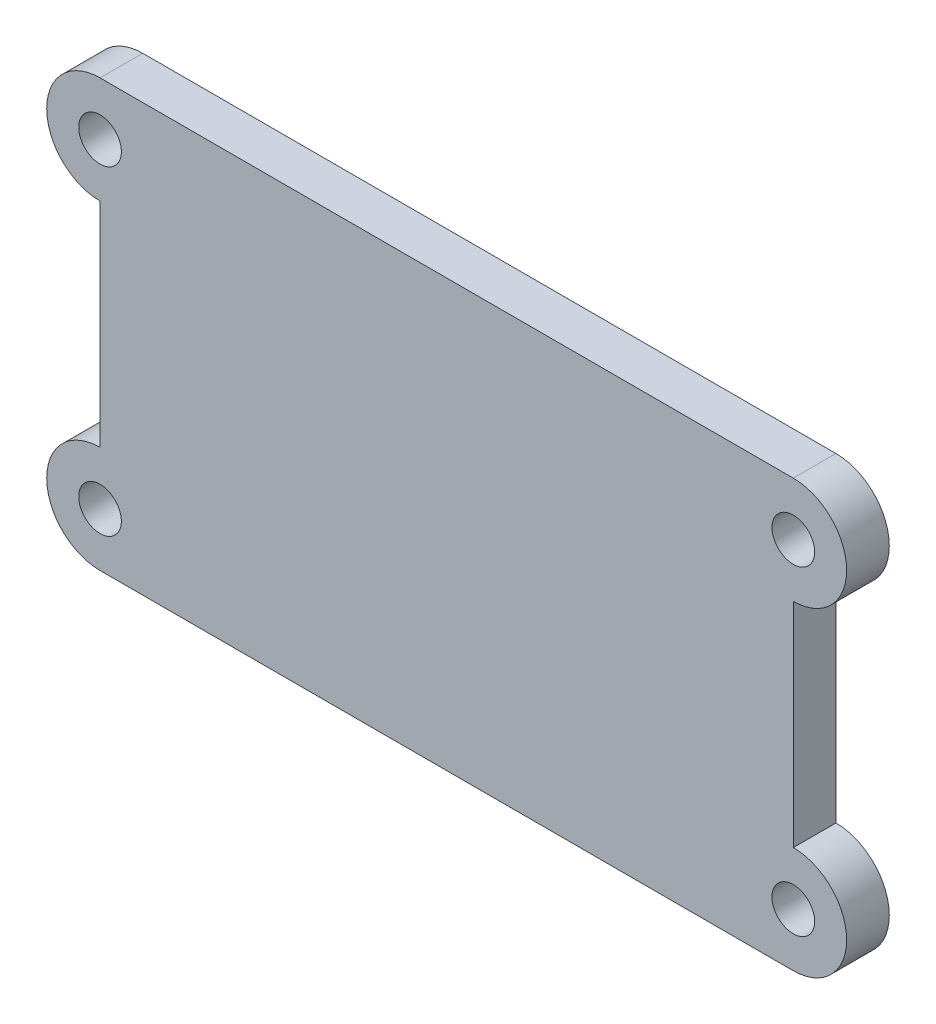
from build123d import *

# Parameters (mm, degrees)
SKETCH1_W                                  = 65
SKETCH1_H                                  = 40
BOSS_EXTRUDE1_DEPTH                        = 4
BOSS_EXTRUDE2_DEPTH                        = 4
SKETCH3_R                                  = 2
CUT_EXTRUDE1_DEPTH                         = 4
MIRROR1_AT_THE_SECOND_PLANE_COPY_1_DEPTH   = 4
MIRROR1_AT_THE_SECOND_PLANE_COPY_2_SKETC_R = 2
MIRROR1_AT_THE_SECOND_PLANE_COPY_2_DEPTH   = 4


with BuildPart() as part:
    # Sketch1 → Boss-Extrude1 (new body)
    with BuildSketch(Plane.XY):
        Rectangle(SKETCH1_W, SKETCH1_H)
    extrude(amount=BOSS_EXTRUDE1_DEPTH)

    # Sketch2 → Boss-Extrude2 (add)
    with BuildSketch(Plane.XY):
        with BuildLine():
            Line((-32.5, 20), (-32.5, 10))
            ThreePointArc((-32.5, 10), (-37.5, 15), (-32.5, 20))
        make_face()
    boss_extrude2 = extrude(amount=BOSS_EXTRUDE2_DEPTH)

    # Sketch3 → Cut-Extrude1 (cut)
    with BuildSketch(Plane.XY.offset(4)):
        with Locations((-32.5, 15)):
            Circle(SKETCH3_R)
    cut_extrude1 = extrude(amount=-CUT_EXTRUDE1_DEPTH, mode=Mode.SUBTRACT)

    # Mirror1: Boss-Extrude2, Cut-Extrude1 across plane
    add(boss_extrude2.mirror(Plane.ZX))
    add(cut_extrude1.mirror(Plane.ZX), mode=Mode.SUBTRACT)

    # Mirror1 at the second plane: Boss-Extrude2, Cut-Extrude1 across plane
    add(boss_extrude2.mirror(Plane(origin=(0, 0, 0), x_dir=(0, 0, 1), z_dir=(1, 0, 0))))
    add(cut_extrude1.mirror(Plane(origin=(0, 0, 0), x_dir=(0, 0, 1), z_dir=(1, 0, 0))), mode=Mode.SUBTRACT)

    # Mirror1 at the second plane copy 1 sketc → Mirror1 at the second plane copy 1 (add)
    with BuildSketch(Plane(origin=(0, 0, 0), x_dir=(-1, 0, 0), z_dir=(0, 0, 1))):
        with BuildLine():
            Line((-32.5, 20), (-32.5, 10))
            ThreePointArc((-32.5, 10), (-37.5, 15), (-32.5, 20))
        make_face()
    extrude(amount=MIRROR1_AT_THE_SECOND_PLANE_COPY_1_DEPTH)

    # Mirror1 at the second plane copy 2 sketc → Mirror1 at the second plane copy 2 (cut)
    with BuildSketch(Plane(origin=(0, 0, 4), x_dir=(-1, 0, 0), z_dir=(0, 0, 1))):
        with Locations((-32.5, 15)):
            Circle(MIRROR1_AT_THE_SECOND_PLANE_COPY_2_SKETC_R)
    extrude(amount=-MIRROR1_AT_THE_SECOND_PLANE_COPY_2_DEPTH, mode=Mode.SUBTRACT)


solid = part.part
